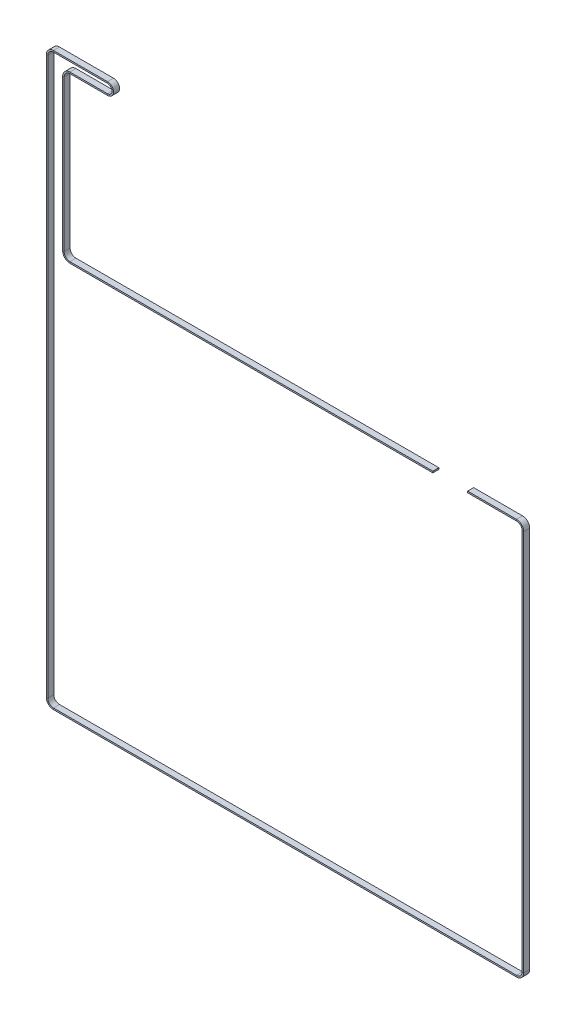
from build123d import *

# Parameters (mm, degrees)
SKETCH2_W = 6
SKETCH2_H = 1.5


with BuildPart() as part:
    # Sweep1: sweep along a path in Sketch1
    with BuildLine(Plane(origin=(0, -21, 4.45), x_dir=(1, 0, 0), z_dir=(0, 0, 1))) as sweep1_path:
        Line((406.705737154, -100.396570146), (455.5, -100.396570146))
        ThreePointArc((455.5, -100.396570146), (460.00780573, -102.263764416), (461.875, -106.771570146))
        Line((461.875, -106.771570146), (461.875, -488))
        ThreePointArc((461.875, -488), (460.00780573, -492.50780573), (455.5, -494.375))
        Line((455.5, -494.375), (-6.5, -494.375))
        ThreePointArc((-6.5, -494.375), (-11.00780573, -492.50780573), (-12.875, -488))
        Line((-12.875, -488), (-12.875, 67.325))
        ThreePointArc((-12.875, 67.325), (-11.00780573, 71.83280573), (-6.5, 73.7))
        Line((-6.5, 73.7), (47.5, 73.7))
        ThreePointArc((47.5, 73.7), (52.7, 68.5), (47.5, 63.3))
        Line((47.5, 63.3), (10, 63.3))
        ThreePointArc((10, 63.3), (5.333095244, 61.366904756), (3.4, 56.7))
        Line((3.4, 56.7), (3.4, -93.946570146))
        ThreePointArc((3.4, -93.946570146), (5.333095244, -98.613474902), (10, -100.546570146))
        Line((10, -100.546570146), (372.005737154, -100.546570146))
    # Sketch2 → Sweep1 (sweep)
    with BuildSketch(Plane(origin=(406.705737154, -121.396570146, 4.45), x_dir=(0, 0, 1), z_dir=(-1, 0, 0))):
        Rectangle(SKETCH2_W, SKETCH2_H)
    sweep(path=sweep1_path.line)


solid = part.part
